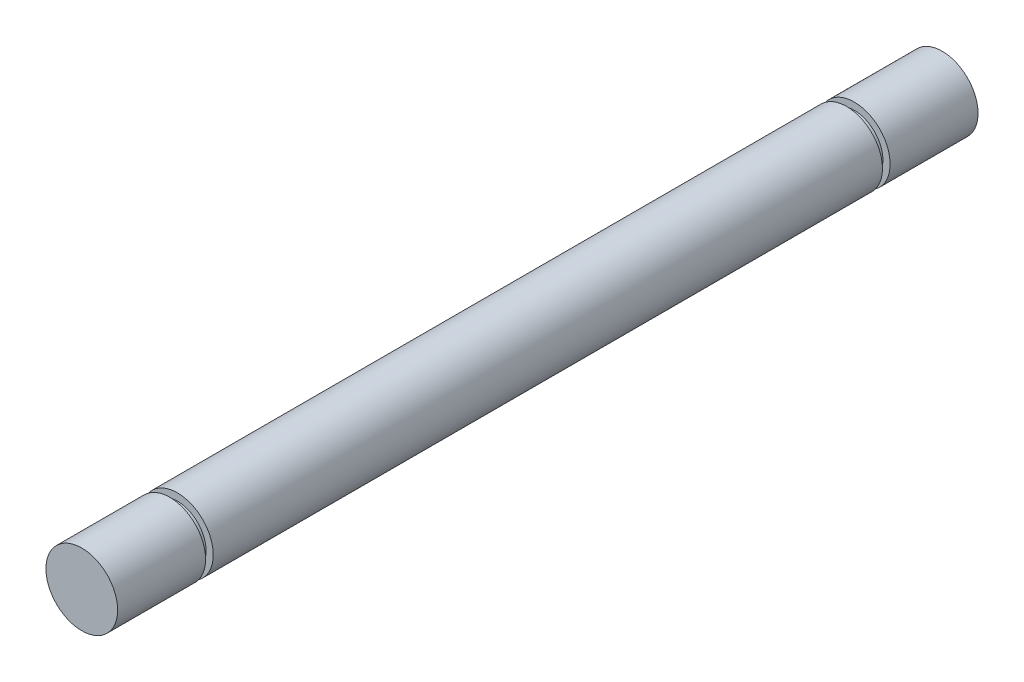
from build123d import *

# Parameters (mm, degrees)
SKETCH1_R           = 4.7625
BOSS_EXTRUDE1_DEPTH = 88.9
SKETCH2_R           = 3.81
BOSS_EXTRUDE2_DEPTH = 1.016
BOSS_EXTRUDE3_START = 11.684
SKETCH3_R           = 4.7625
BOSS_EXTRUDE3_DEPTH = 11.684
BOSS_EXTRUDE4_START = 1.016
SKETCH4_R           = 3.81
BOSS_EXTRUDE4_DEPTH = 1.016
SKETCH5_R           = 4.7625
BOSS_EXTRUDE5_DEPTH = 11.684


with BuildPart() as part:
    # Sketch1 → Boss-Extrude1 (new body)
    with BuildSketch(Plane.XY):
        Circle(SKETCH1_R)
    extrude(amount=BOSS_EXTRUDE1_DEPTH)

    # Sketch2 → Boss-Extrude2 (add)
    with BuildSketch(Plane(origin=(0, 0, 0), x_dir=(-1, 0, 0), z_dir=(0, 0, -1))):
        Circle(SKETCH2_R)
    extrude(amount=BOSS_EXTRUDE2_DEPTH)

    # Sketch3 → Boss-Extrude3 (add)
    with BuildSketch(Plane(origin=(0, 0, -1.016), x_dir=(-1, 0, 0), z_dir=(0, 0, -1)).offset(BOSS_EXTRUDE3_START)):
        Circle(SKETCH3_R)
    extrude(amount=-BOSS_EXTRUDE3_DEPTH)

    # Sketch4 → Boss-Extrude4 (add)
    with BuildSketch(Plane.XY.offset(88.9).offset(BOSS_EXTRUDE4_START)):
        Circle(SKETCH4_R)
    extrude(amount=-BOSS_EXTRUDE4_DEPTH)

    # Sketch5 → Boss-Extrude5 (add)
    with BuildSketch(Plane.XY.offset(89.916)):
        Circle(SKETCH5_R)
    extrude(amount=BOSS_EXTRUDE5_DEPTH)


solid = part.part
